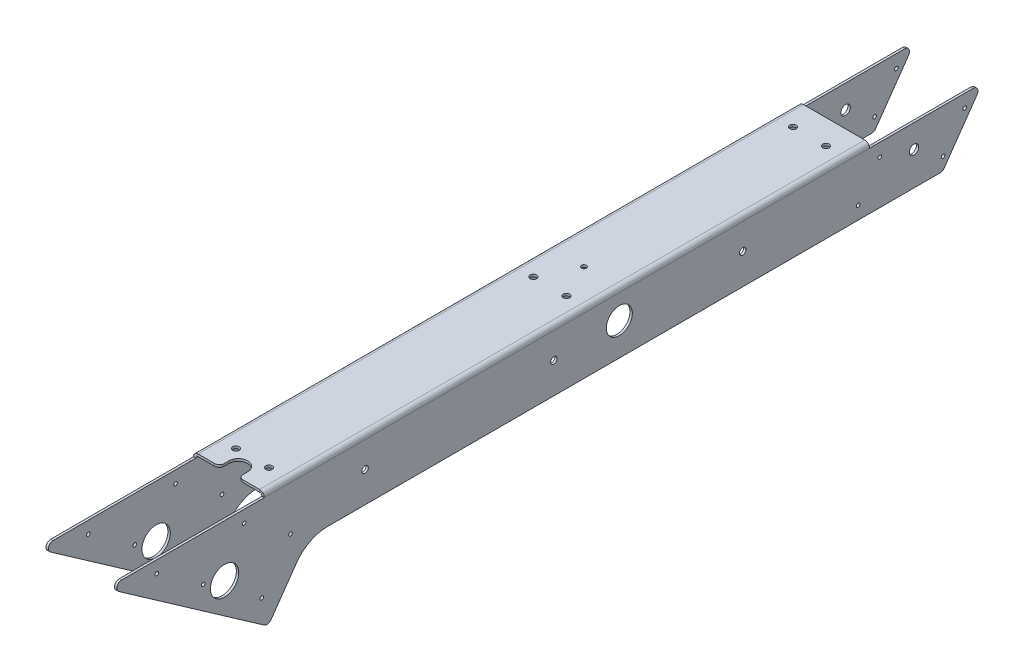
from build123d import *

# Parameters (mm, degrees)
BASE_FLANGE1_DEPTH  = 826.77
BOSS_EXTRUDE1_DEPTH = 3.175
BOSS_EXTRUDE2_START = -95.25
BOSS_EXTRUDE2_DEPTH = 3.175
BOSS_EXTRUDE3_DEPTH = 3.175
BOSS_EXTRUDE4_START = -95.25
BOSS_EXTRUDE4_DEPTH = 3.175
FILLET1_R           = 6.35
SKETCH10_R          = 2.4257
CUT_EXTRUDE1_DEPTH  = 1027.560429748
SKETCH11_R          = 4.3688
CUT_EXTRUDE2_DEPTH  = 1027.560429748
SKETCH12_R          = 17.4625
CUT_EXTRUDE3_DEPTH  = 1027.560429748
SKETCH13_R          = 3.3782
CUT_EXTRUDE4_DEPTH  = 1027.560429748
CUT_EXTRUDE5_DEPTH  = 1027.560429748
SKETCH15_R          = 4.3688
CUT_EXTRUDE6_DEPTH  = 1027.560429748
BOSS_EXTRUDE5_DEPTH = 3.175
BOSS_EXTRUDE6_START = -95.25
BOSS_EXTRUDE6_DEPTH = 3.175
SKETCH17_R          = 2.4257
CUT_EXTRUDE7_DEPTH  = 1027.560429748
FILLET3_R           = 50.8
FILLET4_R           = 6.35
SKETCH18_R          = 19.05
CUT_EXTRUDE8_DEPTH  = 1027.560429748
BOSS_EXTRUDE7_START = -3.175
SKETCH19_R          = 2.4257
BOSS_EXTRUDE7_DEPTH = 3.175
BOSS_EXTRUDE8_START = -3.175
SKETCH20_R          = 2.4257
BOSS_EXTRUDE8_DEPTH = 3.175
SKETCH21_R          = 2.4257
CUT_EXTRUDE9_DEPTH  = 1027.560429748
SKETCH22_R          = 6.35
CUT_EXTRUDE10_DEPTH = 1027.560429748
CUT_EXTRUDE11_DEPTH = 6.35
CUT_EXTRUDE12_START = -6.35
SKETCH24_W          = 28.575
SKETCH24_H          = 3.175
CUT_EXTRUDE12_DEPTH = 6.35
FILLET2_R           = 6.35


# Sheet-metal steps are written as plain solids
with BuildPart() as part:
    # Sketch1 → Base-Flange1 (new body)
    with BuildSketch(Plane.XY):
        with BuildLine():
            Line((0, 0), (0, 76.2))
            ThreePointArc((0, 76.2), (1.859871939, 80.690128061), (6.35, 82.55))
            Line((6.35, 82.55), (88.9, 82.55))
            ThreePointArc((88.9, 82.55), (93.390128061, 80.690128061), (95.25, 76.2))
            Line((95.25, 76.2), (95.25, 0))
            Line((95.25, 0), (92.075, 0))
            Line((92.075, 0), (92.075, 76.2))
            ThreePointArc((92.075, 76.2), (91.14506403, 78.44506403), (88.9, 79.375))
            Line((88.9, 79.375), (6.35, 79.375))
            ThreePointArc((6.35, 79.375), (4.10493597, 78.44506403), (3.175, 76.2))
            Line((3.175, 76.2), (3.175, 0))
            Line((3.175, 0), (0, 0))
        make_face()
    extrude(amount=BASE_FLANGE1_DEPTH)

    # Sketch8 → Boss-Extrude1 (add)
    with BuildSketch(Plane(origin=(95.25, 0, 0), x_dir=(0, 0, -1), z_dir=(1, 0, 0))):
        Polygon((-826.77, 0), (-923.757785236, 0), (-1032.58266335, 76.2), (-826.77, 76.2), align=None)
    extrude(amount=-BOSS_EXTRUDE1_DEPTH)

    # Sketch8<2> → Boss-Extrude2 (add)
    with BuildSketch(Plane(origin=(95.25, 0, 0), x_dir=(0, 0, -1), z_dir=(1, 0, 0)).offset(BOSS_EXTRUDE2_START)):
        Polygon((-826.77, 0), (-923.757785236, 0), (-1032.58266335, 76.2), (-826.77, 76.2), align=None)
    extrude(amount=BOSS_EXTRUDE2_DEPTH)

    # Sketch9 → Boss-Extrude3 (add)
    with BuildSketch(Plane(origin=(95.25, 0, 0), x_dir=(0, 0, -1), z_dir=(1, 0, 0))):
        Polygon((0, 76.2), (145.348474474, 76.2), (91.992660063, 0), (0, 0), align=None)
    extrude(amount=-BOSS_EXTRUDE3_DEPTH)

    # Sketch9<3> → Boss-Extrude4 (add)
    with BuildSketch(Plane(origin=(95.25, 0, 0), x_dir=(0, 0, -1), z_dir=(1, 0, 0)).offset(BOSS_EXTRUDE4_START)):
        Polygon((0, 76.2), (145.348474474, 76.2), (91.992660063, 0), (0, 0), align=None)
    extrude(amount=BOSS_EXTRUDE4_DEPTH)

    # Fillet1
    fillet1_edges = [part.edges().sort_by_distance(p)[0] for p in [
        (93.6625, 0, 923.757785236),
        (93.6625, 76.2, 1032.58266335),
        (1.5875, 0, 923.757785236),
        (1.5875, 76.2, 1032.58266335),
        (93.6625, 76.2, -145.348474474),
        (93.6625, 0, -91.992660063),
        (1.5875, 76.2, -145.348474474),
        (1.5875, 0, -91.992660063),
    ]]
    fillet(fillet1_edges, radius=FILLET1_R)

    # Sketch10 → Cut-Extrude1 (cut, through all)
    with BuildSketch(Plane(origin=(95.25, 0, 0), x_dir=(0, 0, -1), z_dir=(1, 0, 0))):
        with Locations(Location((102.231734197, 58.906461925, 0), (0, 0, 90))):
            Circle(SKETCH10_R)
        with Locations(Location((73.094051231, 17.293538075, 0), (0, 0, 90))):
            Circle(SKETCH10_R)
        with Locations(Location((26.031734197, 58.906461925, 0), (0, 0, 90))):
            Circle(SKETCH10_R)
        with Locations(Location((-3.105948769, 17.293538075, 0), (0, 0, 90))):
            Circle(SKETCH10_R)
        with Locations(Location((-965.096368571, 59.953262225, 0), (0, 0, 90))):
            Circle(SKETCH10_R)
        with Locations(Location((-902.676982797, 16.246737775, 0), (0, 0, 90))):
            Circle(SKETCH10_R)
        with Locations(Location((-847.621368571, 59.953262225, 0), (0, 0, 90))):
            Circle(SKETCH10_R)
        with Locations(Location((-785.201982797, 16.246737775, 0), (0, 0, 90))):
            Circle(SKETCH10_R)
    extrude(amount=-CUT_EXTRUDE1_DEPTH, mode=Mode.SUBTRACT)

    # Sketch11 → Cut-Extrude2 (cut, through all)
    with BuildSketch(Plane(origin=(0, 82.55, 0), x_dir=(1, 0, 0), z_dir=(0, 1, 0))):
        with Locations(Location((69.85, -788.67, 0), (0, 0, 270))):
            Circle(SKETCH11_R)
        with Locations(Location((69.85, -39.37, 0), (0, 0, 270))):
            Circle(SKETCH11_R)
        with Locations(Location((69.85, -388.62, 0), (0, 0, 270))):
            Circle(SKETCH11_R)
        with Locations(Location((25.4, -388.62, 0), (0, 0, 270))):
            Circle(SKETCH11_R)
        with Locations(Location((25.4, -39.37, 0), (0, 0, 270))):
            Circle(SKETCH11_R)
        with Locations(Location((25.4, -788.67, 0), (0, 0, 270))):
            Circle(SKETCH11_R)
    extrude(amount=-CUT_EXTRUDE2_DEPTH, mode=Mode.SUBTRACT)

    # Sketch12 → Cut-Extrude3 (cut, through all)
    with BuildSketch(Plane(origin=(95.25, 0, 0), x_dir=(0, 0, -1), z_dir=(1, 0, 0))):
        with Locations(Location((-342.9, 43.6245, 0), (0, 0, 90))):
            Circle(SKETCH12_R)
    extrude(amount=-CUT_EXTRUDE3_DEPTH, mode=Mode.SUBTRACT)

    # Sketch13 → Cut-Extrude4 (cut, through all)
    with BuildSketch(Plane(origin=(0, 82.55, 0), x_dir=(1, 0, 0), z_dir=(0, 1, 0))):
        with Locations(Location((47.625, -342.9, 0), (0, 0, 270))):
            Circle(SKETCH13_R)
    extrude(amount=-CUT_EXTRUDE4_DEPTH, mode=Mode.SUBTRACT)

    # Sketch14 → Cut-Extrude5 (cut, through all)
    with BuildSketch(Plane(origin=(0, 82.55, 0), x_dir=(1, 0, 0), z_dir=(0, 1, 0))):
        with BuildLine():
            Line((34.925, -826.77), (60.325, -826.77))
            Line((60.325, -826.77), (60.325, -807.72))
            ThreePointArc((60.325, -807.72), (47.625, -795.02), (34.925, -807.72))
            Line((34.925, -807.72), (34.925, -826.77))
        make_face()
    extrude(amount=-CUT_EXTRUDE5_DEPTH, mode=Mode.SUBTRACT)

    # Sketch15 → Cut-Extrude6 (cut, through all)
    with BuildSketch(Plane(origin=(95.25, 0, 0), x_dir=(0, 0, -1), z_dir=(1, 0, 0))):
        with Locations(Location((-430.905434006, 41.275, 0), (0, 0, 90))):
            Circle(SKETCH15_R)
        with Locations(Location((-684.905434006, 41.275, 0), (0, 0, 90))):
            Circle(SKETCH15_R)
        with Locations(Location((-176.905434006, 41.275, 0), (0, 0, 90))):
            Circle(SKETCH15_R)
    extrude(amount=-CUT_EXTRUDE6_DEPTH, mode=Mode.SUBTRACT)

    # Sketch16 → Boss-Extrude5 (add)
    with BuildSketch(Plane.ZY):
        with BuildLine():
            Line((921.755637927, 0), (761.999236627, 0))
            Line((761.999236627, 0), (815.216169942, -76.001657238))
            Line((815.216169942, -76.001657238), (925.397848297, 1.148384519))
            ThreePointArc((925.397848297, 1.148384519), (923.665119753, 0.293897363), (921.755637927, 0))
        make_face()
    extrude(amount=-BOSS_EXTRUDE5_DEPTH)

    # Sketch16<2> → Boss-Extrude6 (add)
    with BuildSketch(Plane.ZY.offset(BOSS_EXTRUDE6_START)):
        with BuildLine():
            Line((921.755637927, 0), (761.999236627, 0))
            Line((761.999236627, 0), (815.216169942, -76.001657238))
            Line((815.216169942, -76.001657238), (925.397848297, 1.148384519))
            ThreePointArc((925.397848297, 1.148384519), (923.665119753, 0.293897363), (921.755637927, 0))
        make_face()
    extrude(amount=BOSS_EXTRUDE6_DEPTH)

    # Sketch17 → Cut-Extrude7 (cut, through all)
    with BuildSketch(Plane.ZY):
        with Locations((823.850074628, -38.948457538)):
            Circle(SKETCH17_R)
    extrude(amount=-CUT_EXTRUDE7_DEPTH, mode=Mode.SUBTRACT)

    # Fillet3
    fillet3_edges = [part.edges().sort_by_distance(p)[0] for p in [
        (1.5875, 0, 761.999236627),
        (93.6625, 0, 761.999236627),
    ]]
    fillet(fillet3_edges, radius=FILLET3_R)

    # Fillet4
    fillet4_edges = [part.edges().sort_by_distance(p)[0] for p in [
        (1.5875, -76.001657238, 815.216169942),
        (93.6625, -76.001657238, 815.216169942),
    ]]
    fillet(fillet4_edges, radius=FILLET4_R)

    # Sketch18 → Cut-Extrude8 (cut, through all)
    with BuildSketch(Plane.ZY):
        with Locations((873.857381249, 6.144529753)):
            Circle(SKETCH18_R)
    extrude(amount=-CUT_EXTRUDE8_DEPTH, mode=Mode.SUBTRACT)

    # Sketch19 → Boss-Extrude7 (add)
    with BuildSketch(Plane.ZY.offset(BOSS_EXTRUDE7_START)):
        with Locations(Location((-26.031734197, 58.906461925, 0), (0, 0, 90))):
            Circle(SKETCH19_R)
        with Locations(Location((3.105948769, 17.293538075, 0), (0, 0, 90))):
            Circle(SKETCH19_R)
        with Locations(Location((-73.094051231, 17.293538075, 0), (0, 0, 90))):
            Circle(SKETCH19_R)
        with Locations(Location((-102.231734197, 58.906461925, 0), (0, 0, 90))):
            Circle(SKETCH19_R)
    extrude(amount=BOSS_EXTRUDE7_DEPTH)

    # Sketch20 → Boss-Extrude8 (add)
    with BuildSketch(Plane(origin=(95.25, 0, 0), x_dir=(0, 0, -1), z_dir=(1, 0, 0)).offset(BOSS_EXTRUDE8_START)):
        with Locations((102.231734197, 58.906461925)):
            Circle(SKETCH20_R)
        with Locations((73.094051231, 17.293538075)):
            Circle(SKETCH20_R)
        with Locations((-3.105948769, 17.293538075)):
            Circle(SKETCH20_R)
        with Locations((26.031734197, 58.906461925)):
            Circle(SKETCH20_R)
    extrude(amount=BOSS_EXTRUDE8_DEPTH)

    # Sketch21 → Cut-Extrude9 (cut, through all)
    with BuildSketch(Plane.ZY):
        with Locations((-121.611530794, 58.906461925)):
            Circle(SKETCH21_R)
        with Locations((-92.473847827, 17.293538075)):
            Circle(SKETCH21_R)
        with Locations((-7.311530794, 58.906461925)):
            Circle(SKETCH21_R)
        with Locations((21.826152173, 17.293538075)):
            Circle(SKETCH21_R)
    extrude(amount=-CUT_EXTRUDE9_DEPTH, mode=Mode.SUBTRACT)

    # Sketch22 → Cut-Extrude10 (cut, through all)
    with BuildSketch(Plane.ZY):
        with Locations((-53.461731718, 44.610115856)):
            Circle(SKETCH22_R)
    extrude(amount=-CUT_EXTRUDE10_DEPTH, mode=Mode.SUBTRACT)

    # Sketch23 → Cut-Extrude11 (cut)
    with BuildSketch(Plane(origin=(0, 0, 0), x_dir=(-1, 0, 0), z_dir=(0, 0, -1))):
        with BuildLine():
            Line((-3.175, 76.2), (0, 76.2))
            ThreePointArc((0, 76.2), (-1.859871939, 80.690128061), (-6.35, 82.55))
            Line((-6.35, 82.55), (-88.9, 82.55))
            ThreePointArc((-88.9, 82.55), (-93.390128061, 80.690128061), (-95.25, 76.2))
            Line((-95.25, 76.2), (-92.075, 76.2))
            ThreePointArc((-92.075, 76.2), (-91.14506403, 78.44506403), (-88.9, 79.375))
            Line((-88.9, 79.375), (-6.35, 79.375))
            ThreePointArc((-6.35, 79.375), (-4.10493597, 78.44506403), (-3.175, 76.2))
        make_face()
    extrude(amount=-CUT_EXTRUDE11_DEPTH, mode=Mode.SUBTRACT)

    # Sketch24 → Cut-Extrude12 (cut)
    with BuildSketch(Plane.XY.offset(826.77).offset(CUT_EXTRUDE12_START)):
        with BuildLine():
            ThreePointArc((6.35, 79.375), (4.10493597, 78.44506403), (3.175, 76.2))
            Line((3.175, 76.2), (0, 76.2))
            ThreePointArc((0, 76.2), (1.859871939, 80.690128061), (6.35, 82.55))
            Line((6.35, 82.55), (34.925, 82.55))
            Line((34.925, 82.55), (34.925, 79.375))
            Line((34.925, 79.375), (6.35, 79.375))
        make_face()
        with Locations((74.6125, 80.9625)):
            Rectangle(SKETCH24_W, SKETCH24_H)
        with BuildLine():
            ThreePointArc((92.075, 76.2), (91.14506403, 78.44506403), (88.9, 79.375))
            Line((88.9, 79.375), (88.9, 82.55))
            ThreePointArc((88.9, 82.55), (93.390128061, 80.690128061), (95.25, 76.2))
            Line((95.25, 76.2), (92.075, 76.2))
        make_face()
    extrude(amount=CUT_EXTRUDE12_DEPTH, mode=Mode.SUBTRACT)

    # Fillet2
    fillet2_edges = [part.edges().sort_by_distance(p)[0] for p in [
        (60.325, 80.9625, 820.42),
        (34.925, 80.9625, 820.42),
    ]]
    fillet(fillet2_edges, radius=FILLET2_R)


solid = part.part
